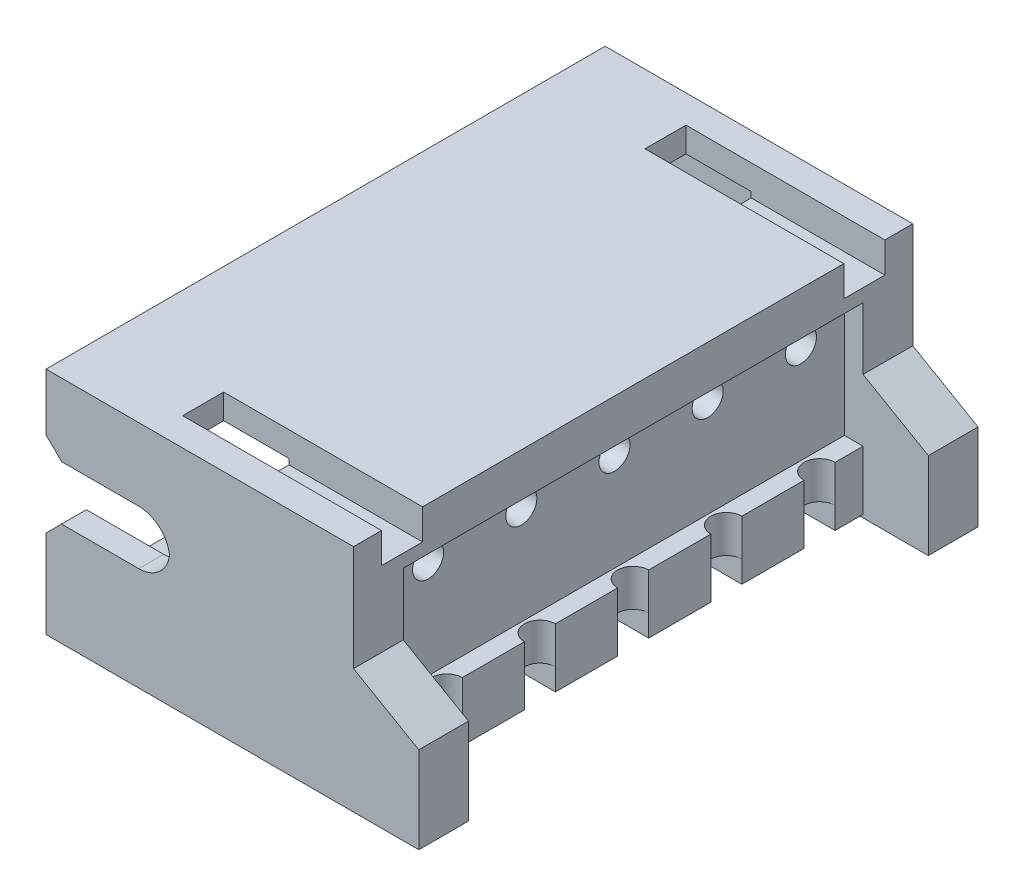
from build123d import *

# Parameters (mm, degrees)
SKETCH_1_W               = 6
SKETCH_1_H               = 3.7
EXTRUDE_1_DEPTH          = 9
SKETCH_2_W               = 1.993366308
SKETCH_2_H               = 0.87
CUT_EXTRUDE_1_DEPTH      = 12.431972708
CHAMFER_1_SIZE           = 0.25
FILLET_1_R               = 0.5
SKETCH_3_W               = 8.2
SKETCH_3_H               = 2.9
CUT_EXTRUDE_2_DEPTH      = 2.8
SKETCH_4_W               = 7.4
SKETCH_4_H               = 3
CUT_EXTRUDE_3_DEPTH      = 1.05
SKETCH_5_W               = 7.4
SKETCH_5_H               = 2
CUT_EXTRUDE_4_DEPTH      = 0.3
SKETCH_6_R               = 0.25
CUT_EXTRUDE_5_DEPTH      = 1
SKETCH_7_R               = 0.25
CUT_EXTRUDE_6_DEPTH      = 11.784827305
SKETCH_8_W               = 1
SKETCH_8_H               = 0.5
CUT_EXTRUDE_7_DEPTH      = 0.4
CUT_EXTRUDE_8_DEPTH      = 12.431972708
CUT_EXTRUDE_8_DEPTH_BACK = 0.05
SKETCH_10_W              = 0.66
SKETCH_10_H              = 0.49
CUT_EXTRUDE_9_DEPTH      = 3.2
SKETCH_11_W              = 8.2
SKETCH_11_H              = 1.5
CUT_EXTRUDE_10_DEPTH     = 0.25
SKETCH_12_W              = 1.5
SKETCH_12_H              = 1.5
CUT_EXTRUDE_11_DEPTH     = 0.05
CHAMFER_2_SIZE           = 0.3


# Some blends are built 0.0001 mm under size
with BuildPart() as part:
    # 스케치1 → 보스-돌출1 (new body)
    with BuildSketch(Plane.XY):
        with Locations((3, 1.85)):
            Rectangle(SKETCH_1_W, SKETCH_1_H)
    extrude(amount=EXTRUDE_1_DEPTH)

    # 스케치2 → 컷-돌출1 (cut, through all)
    with BuildSketch(Plane.XY.offset(9)):
        Polygon((6, 3.7), (4.95, 3.7), (4.95, 2), (6, 1.393782217), align=None)
        with Locations((0.996683154, 2.1)):
            Rectangle(SKETCH_2_W, SKETCH_2_H)
    extrude(amount=-CUT_EXTRUDE_1_DEPTH, mode=Mode.SUBTRACT)

    # 모따기1
    chamfer_1_edges = [part.edges().sort_by_distance(p)[0] for p in [
        (0, 1.665, 4.5),
        (0, 2.535, 4.5),
    ]]
    chamfer(chamfer_1_edges, length=CHAMFER_1_SIZE)

    # 필렛1
    # the kernel refuses this fillet: 0.5 mm, written as the material it adds along each edge
    with BuildSketch(Plane(origin=(1.993366308, 1.665, 9), x_dir=(-1, 0, 0), z_dir=(0, 0, -1)), Plane(origin=(1.993366308, 2.535, 9), x_dir=(0, -1, 0), z_dir=(0, 0, -1))) as fillet_1_piece_1:
        with BuildLine():
            CenterArc((FILLET_1_R, FILLET_1_R), FILLET_1_R, 180, 90)
            Line((0, FILLET_1_R), (0, 0))
            Line((0, 0), (FILLET_1_R, 0))
        make_face()
    extrude(amount=9)

    # 스케치3 → 컷-돌출2 (cut)
    with BuildSketch(Plane.ZY):
        with Locations((4.5, 1.85)):
            Rectangle(SKETCH_3_W, SKETCH_3_H)
    extrude(amount=-CUT_EXTRUDE_2_DEPTH, mode=Mode.SUBTRACT)

    # 스케치4 → 컷-돌출3 (cut)
    with BuildSketch(Plane(origin=(6, 0, 0), x_dir=(0, 0, -1), z_dir=(1, 0, 0))):
        with Locations((-4.5, 1.5)):
            Rectangle(SKETCH_4_W, SKETCH_4_H)
    extrude(amount=-CUT_EXTRUDE_3_DEPTH, mode=Mode.SUBTRACT)

    # 스케치5 → 컷-돌출4 (cut)
    with BuildSketch(Plane(origin=(4.95, 0, 0), x_dir=(0, 0, -1), z_dir=(1, 0, 0))):
        with Locations((-4.5, 2)):
            Rectangle(SKETCH_5_W, SKETCH_5_H)
    extrude(amount=-CUT_EXTRUDE_4_DEPTH, mode=Mode.SUBTRACT)

    # 스케치6 → 컷-돌출5 (cut)
    with BuildSketch(Plane.XZ):
        with Locations((4.95, 4.5)):
            Circle(SKETCH_6_R)
        with Locations((4.95, 6)):
            Circle(SKETCH_6_R)
        with Locations((4.95, 3)):
            Circle(SKETCH_6_R)
        with Locations((4.95, 7.5)):
            Circle(SKETCH_6_R)
        with Locations((4.95, 1.5)):
            Circle(SKETCH_6_R)
    extrude(amount=-CUT_EXTRUDE_5_DEPTH, mode=Mode.SUBTRACT)

    # 스케치7 → 컷-돌출6 (cut, through all)
    with BuildSketch(Plane(origin=(4.65, 0, 0), x_dir=(0, 0, -1), z_dir=(1, 0, 0))):
        with Locations((-7.5, 2.6)):
            Circle(SKETCH_7_R)
        with Locations((-6, 2.6)):
            Circle(SKETCH_7_R)
        with Locations((-4.5, 2.6)):
            Circle(SKETCH_7_R)
        with Locations((-3, 2.6)):
            Circle(SKETCH_7_R)
        with Locations((-1.5, 2.6)):
            Circle(SKETCH_7_R)
    extrude(amount=-CUT_EXTRUDE_6_DEPTH, mode=Mode.SUBTRACT)

    # 스케치8 → 컷-돌출7 (cut)
    with BuildSketch(Plane.XZ):
        with Locations((4.45, 7.5)):
            Rectangle(SKETCH_8_W, SKETCH_8_H)
        with Locations((4.45, 6)):
            Rectangle(SKETCH_8_W, SKETCH_8_H)
        with Locations((4.45, 4.5)):
            Rectangle(SKETCH_8_W, SKETCH_8_H)
        with Locations((4.45, 3)):
            Rectangle(SKETCH_8_W, SKETCH_8_H)
        with Locations((4.45, 1.5)):
            Rectangle(SKETCH_8_W, SKETCH_8_H)
    extrude(amount=-CUT_EXTRUDE_7_DEPTH, mode=Mode.SUBTRACT)

    # 스케치9 → 컷-돌출8 (cut, two sides: drawn at the far end of the back side and taken through both)
    with BuildSketch(Plane.XZ.offset(-CUT_EXTRUDE_8_DEPTH_BACK)):
        Polygon((4.95, 8.2), (0, 8.2), (0, 4.85), (3.95, 4.85), (3.95, 4.75), (4.95, 4.75), (4.95, 5.75), (3.95, 5.75), (3.95, 6.25), (4.95, 6.25), (4.95, 7.25), (3.95, 7.25), (3.95, 7.75), (4.95, 7.75), align=None)
        Polygon((3.95, 4.15), (0, 4.15), (0, 0.8), (4.95, 0.8), (4.95, 1.25), (3.95, 1.25), (3.95, 1.75), (4.95, 1.75), (4.95, 2.75), (3.95, 2.75), (3.95, 3.25), (4.95, 3.25), (4.95, 4.25), (3.95, 4.25), align=None)
    extrude(amount=CUT_EXTRUDE_8_DEPTH + CUT_EXTRUDE_8_DEPTH_BACK, mode=Mode.SUBTRACT)

    # 스케치10 → 컷-돌출9 (cut)
    with BuildSketch(Plane(origin=(4.95, 0, 0), x_dir=(0, 0, -1), z_dir=(1, 0, 0))):
        with Locations((-8.22, 3.455)):
            Rectangle(SKETCH_10_W, SKETCH_10_H)
        with Locations((-0.78, 3.455)):
            Rectangle(SKETCH_10_W, SKETCH_10_H)
    extrude(amount=-CUT_EXTRUDE_9_DEPTH, mode=Mode.SUBTRACT)

    # 스케치11 → 컷-돌출10 (cut)
    with BuildSketch(Plane.ZY.offset(-2.8)):
        with Locations((4.5, 1.15)):
            Rectangle(SKETCH_11_W, SKETCH_11_H)
    extrude(amount=-CUT_EXTRUDE_10_DEPTH, mode=Mode.SUBTRACT)

    # 스케치12 → 컷-돌출11 (cut)
    with BuildSketch(Plane.ZY.offset(-3.05)):
        with Locations((4.5, 1.15)):
            Rectangle(SKETCH_12_W, SKETCH_12_H)
    extrude(amount=-CUT_EXTRUDE_11_DEPTH, mode=Mode.SUBTRACT)

    # 모따기2
    chamfer_2_edges = [part.edges().sort_by_distance(p)[0] for p in [
        (2.8, 1.9, 4.5),
    ]]
    chamfer(chamfer_2_edges, length=CHAMFER_2_SIZE - 0.0001)  # a hair under: the kernel refuses the full size


solid = part.part
